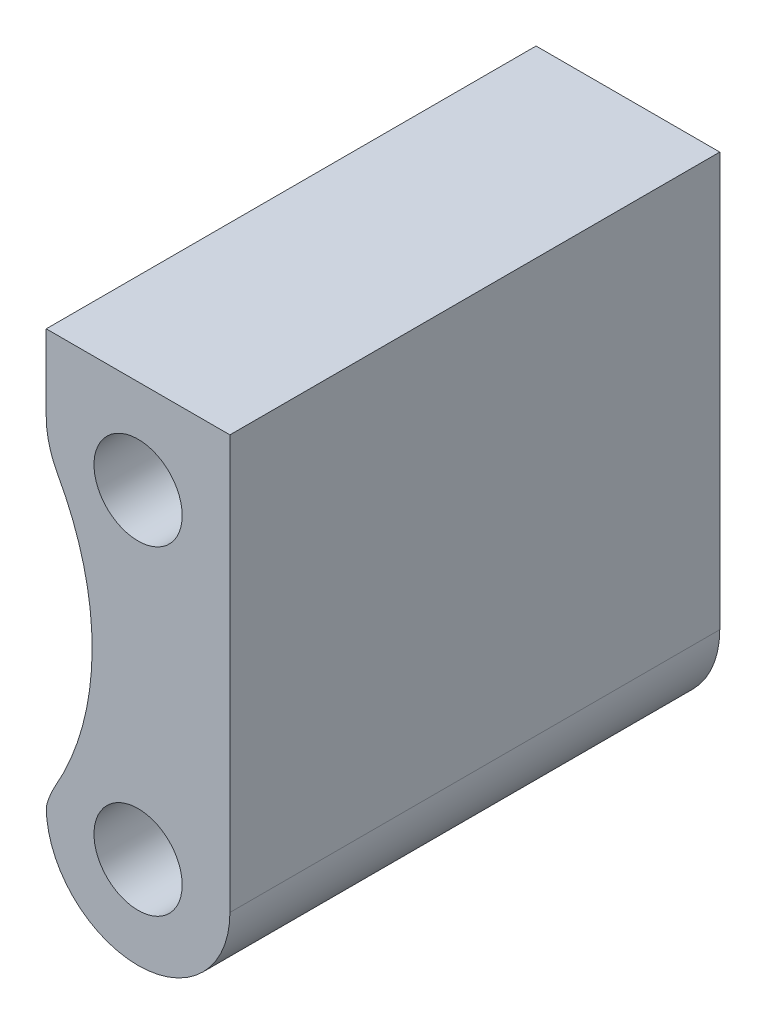
from build123d import *

# Parameters (mm, degrees)
SKETCH1_R           = 2.286
BOSS_EXTRUDE1_DEPTH = 25.4
SKETCH2_R           = 14.2875
CUT_EXTRUDE1_DEPTH  = 34.583444905
FILLET1_R           = 4.7625


with BuildPart() as part:
    # Sketch1 → Boss-Extrude1 (new body)
    with BuildSketch(Plane.XY):
        with BuildLine():
            Line((4.7625, 16.5862), (4.7625, 0))
            ThreePointArc((4.7625, 0), (0, -4.7625), (-4.7625, 0))
            Line((-4.7625, 0), (-4.7625, 16.5862))
            Line((-4.7625, 16.5862), (-4.7625, 21.447758984))
            Line((-4.7625, 21.447758984), (4.7625, 21.447758984))
            Line((4.7625, 21.447758984), (4.7625, 16.5862))
        make_face()
        Circle(SKETCH1_R, mode=Mode.SUBTRACT)
        with Locations((0, 16.5862)):
            Circle(SKETCH1_R, mode=Mode.SUBTRACT)
    extrude(amount=BOSS_EXTRUDE1_DEPTH)

    # Sketch2 → Cut-Extrude1 (cut, through all)
    with BuildSketch(Plane.XY.offset(25.4)):
        with Locations((-16.67002, 8.2931)):
            Circle(SKETCH2_R)
    extrude(amount=-CUT_EXTRUDE1_DEPTH, mode=Mode.SUBTRACT)

    # Fillet1
    # the kernel refuses this fillet: 4.7625 mm, written as the material it takes off along each edge
    with BuildSketch(Plane(origin=(-4.7625, 0.397302149, -2.281929285), x_dir=(0.5257327344691161, 0.8506498056824712, 0), z_dir=(0, 0, 1))) as fillet1_piece_1:
        with BuildLine():
            CenterArc((1.064900333, -4.760069656), FILLET1_R, 91.830511452, 15.300937173)
            Line((-0.337964996, -0.208874745), (-0.366022303, -0.117850847))
            ThreePointArc((-0.366022303, -0.117850847), (-0.219058541, -0.023412979), (-0.050076043, 0.081024394))
            Line((-0.050076043, 0.081024394), (0.003042572, 0.095201393))
            ThreePointArc((0.003042572, 0.095201393), (0.456385857, 0.087958969), (0.909729142, 0.095201393))
            Line((0.909729142, 0.095201393), (0.912771714, 0))
        make_face()
    extrude(amount=29.963858571, mode=Mode.SUBTRACT)
    with BuildSketch(Plane(origin=(-4.7625, 16.188897851, -3.311119953), x_dir=(0, 1, 0), z_dir=(0, 0, 1))) as fillet1_piece_2:
        with BuildLine():
            CenterArc((1.324447981, -4.7625), FILLET1_R, 90, 28.947133413)
            Line((-0.980613477, -0.594995), (-1.026714706, -0.5116449))
            ThreePointArc((-1.026714706, -0.5116449), (-0.533743292, -0.225909554), (-0.052638652, 0.079383467))
            Line((-0.052638652, 0.079383467), (0, 0.09525))
            Line((0, 0.09525), (1.324447981, 0.09525))
            Line((1.324447981, 0.09525), (1.324447981, 0))
        make_face()
    extrude(amount=32.022239906, mode=Mode.SUBTRACT)


solid = part.part
